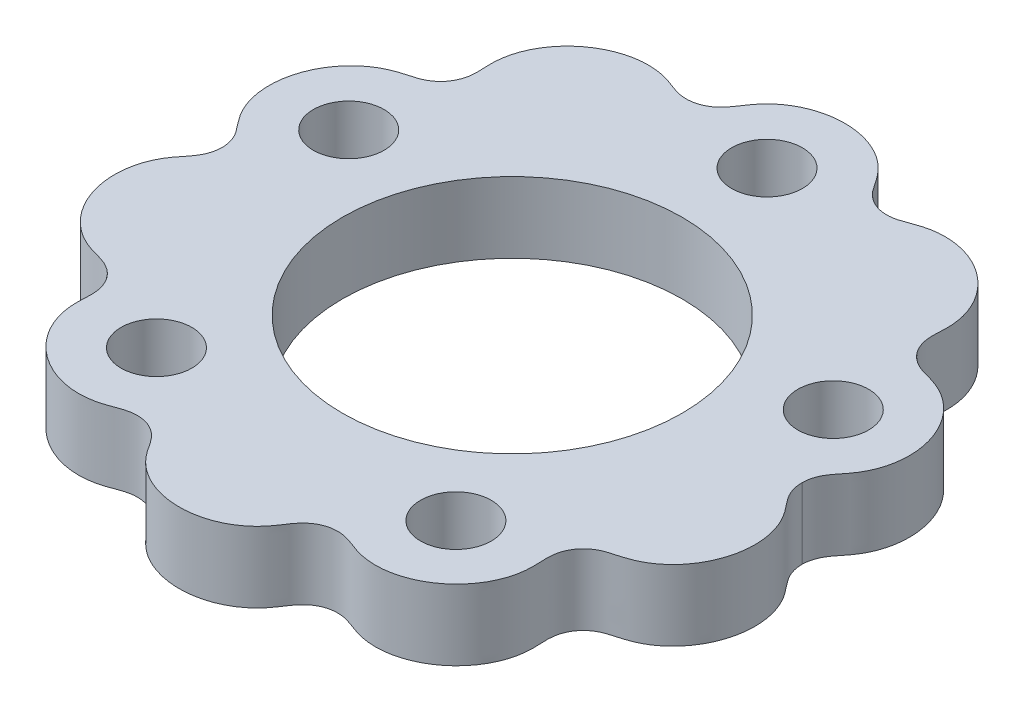
from build123d import *

# Parameters (mm, degrees)
BOSS_EXTRUDE1_OUTLINE_R = 12
BOSS_EXTRUDE1_DEPTH     = 5
SKETCH2_R               = 2.5
CUT_EXTRUDE1_DEPTH      = 34.029669097


# Read off the part's stored shape, not the designer's step: Boss-Extrude1
with BuildPart() as part:
    # Boss-Extrude1 outline → Boss-Extrude1 (new body)
    with BuildSketch(Plane(origin=(0, 0, 0), x_dir=(1, 0, 0), z_dir=(0, 1, 0))):
        with BuildLine():
            ThreePointArc((20.483482608, -0.022701296), (20.482946027, 0.001669628), (20.484024222, 0.026022603))
            add(Edge.make_bspline(
                [(20.484024222, 0.026022603), (20.487498075, 0.188449943), (20.530692051, 0.524452044), (20.676605138, 0.939855681), (20.802634756, 1.18673961), (20.961995807, 1.448332504), (21.103456977, 1.638126813), (21.234268351, 1.805069819), (21.341850472, 1.938204845), (21.465407288, 2.092648377), (21.599078876, 2.266000463), (21.740930616, 2.465610009), (21.913489757, 2.732637863), (22.102223598, 3.075517883), (22.289904472, 3.509157538), (22.437675663, 3.962561926), (22.544640093, 4.431900547), (22.631850119, 5.073155969), (22.635931659, 5.892477364), (22.474096645, 6.86952319), (22.151728017, 7.808025598), (21.679261623, 8.677237815), (21.173033913, 9.319065357), (20.710752428, 9.768857794), (20.338353665, 10.071217564), (19.943847721, 10.335367186), (19.598891474, 10.521922061), (19.311964608, 10.651672399), (19.091956238, 10.738997875), (18.861451659, 10.818617448), (18.61317139, 10.893641797), (18.375579531, 10.957979655), (18.124796572, 11.027363516), (17.87665533, 11.103974461), (17.555751292, 11.224627206), (17.173288609, 11.441745247), (16.81334335, 11.727777943), (16.474600981, 12.147137503), (16.187739874, 12.75401822), (16.110035958, 13.286707461), (16.101145961, 13.633535427), (16.108138063, 13.871526014), (16.117051473, 14.056213577), (16.127246931, 14.261703011), (16.135044654, 14.487223072), (16.134629824, 14.733331839), (16.12371617, 14.972608497), (16.094845812, 15.286098127), (16.031278198, 15.672776569), (15.910561477, 16.131316665), (15.691813887, 16.731029916), (15.314101069, 17.448746146), (14.712156044, 18.228522502), (13.983552915, 18.900490371), (13.152833257, 19.442864111), (12.247010156, 19.837678366), (11.454948784, 20.031636277), (10.815848468, 20.100832305), (10.337906347, 20.10906687), (9.866841828, 20.073375872), (9.479788087, 20.006734617), (9.173543214, 19.93146259), (8.941882382, 19.863101119), (8.699884696, 19.780888465), (8.478681878, 19.697619173), (8.25439962, 19.612950764), (8.039096318, 19.535005666), (7.722900473, 19.439995413), (7.246293364, 19.345266512), (6.602500608, 19.395481633), (6.089120799, 19.560365293), (5.672117431, 19.808452615), (5.305999577, 20.124285394), (5.078921017, 20.40391826), (4.920311032, 20.626432722), (4.809222169, 20.794669312), (4.689166945, 20.978745579), (4.562040932, 21.169532321), (4.416151439, 21.37314115), (4.268176964, 21.561900668), (4.113737202, 21.741360439), (3.898082894, 21.969212564), (3.608438394, 22.23456811), (3.228852964, 22.521898573), (2.684883678, 22.86029441), (1.943119792, 23.194262658), (0.987404123, 23.439533786), (-0.000909374, 23.522141981), (-0.989212315, 23.439776155), (-1.94492202, 23.194742468), (-2.686678182, 22.860918693), (-3.230573149, 22.522671486), (-3.610133163, 22.235409047), (-3.899718695, 21.970126207), (-4.115528168, 21.742131822), (-4.269891912, 21.562834171), (-4.417749348, 21.374133513), (-4.564935932, 21.169064813), (-4.691828328, 20.978831656), (-4.813775805, 20.79231291), (-4.9285933, 20.620152319), (-5.088480229, 20.396895814), (-5.336126588, 20.100397089), (-5.699324257, 19.799550244), (-5.997626627, 19.62917058), (-6.248701845, 19.523313061), (-6.445301067, 19.459719164), (-6.764166519, 19.390476705), (-7.295847059, 19.36359475), (-7.749251022, 19.460357959), (-8.056533891, 19.554607048), (-8.26732387, 19.631848292), (-8.488541821, 19.71597268), (-8.707472614, 19.798450199), (-8.949916333, 19.881059383), (-9.180488999, 19.949051155), (-9.487273251, 20.024561137), (-9.873745892, 20.091009534), (-10.345284348, 20.126848838), (-10.823029672, 20.118627653), (-11.462410445, 20.049501234), (-12.254502053, 19.855685927), (-13.160508382, 19.461037812), (-13.991355974, 18.918874917), (-14.72010821, 18.247088281), (-15.322164197, 17.467524749), (-15.699958999, 16.749923834), (-15.918725525, 16.150354971), (-16.039433209, 15.691967777), (-16.103025666, 15.305277448), (-16.131967956, 14.991400172), (-16.142813041, 14.753268658), (-16.143356335, 14.504075458), (-16.1357289, 14.280150498), (-16.125631177, 14.072159738), (-16.117023412, 13.883426319), (-16.11083046, 13.641049489), (-16.123194148, 13.281742738), (-16.21061611, 12.731348611), (-16.531307379, 12.106396428), (-16.876461465, 11.710246614), (-17.231913629, 11.441783492), (-17.602663361, 11.240760348), (-17.910777396, 11.127665395), (-18.153454769, 11.054023402), (-18.401200138, 10.98613142), (-18.637103225, 10.922480505), (-18.884171953, 10.848026153), (-19.114338145, 10.768473767), (-19.335001351, 10.680986047), (-19.620928799, 10.551687016), (-19.966514514, 10.364812301), (-20.360963807, 10.10073738), (-20.733455869, 9.798384102), (-21.195859728, 9.348594199), (-21.702289342, 8.706784186), (-22.174963712, 7.837648284), (-22.497573667, 6.899229098), (-22.65962538, 5.922227858), (-22.655723325, 5.103012062), (-22.568623751, 4.461874603), (-22.461695557, 3.992399748), (-22.314078358, 3.539257333), (-22.126420731, 3.105727935), (-21.937559918, 2.76250434), (-21.765038345, 2.49544879), (-21.623590087, 2.296437672), (-21.488037695, 2.120277827), (-21.364983313, 1.966235295), (-21.256446717, 1.830934938), (-21.123255839, 1.662051807), (-20.947084088, 1.414320873), (-20.730052707, 1.057488792), (-20.551889884, 0.508057621), (-20.495642746, -0.006716675), (-20.565308212, -0.539990924), (-20.742785099, -1.047747049), (-20.961660539, -1.410570846), (-21.133990457, -1.645993338), (-21.261320598, -1.808220095), (-21.373112147, -1.947174508), (-21.498886348, -2.103772464), (-21.628834978, -2.272146307), (-21.772382727, -2.474071812), (-21.945383476, -2.741516326), (-22.133866418, -3.083277666), (-22.321964261, -3.517419744), (-22.519348085, -4.1217213), (-22.663804546, -4.917131603), (-22.669181586, -5.90034295), (-22.507818084, -6.87743216), (-22.185890414, -7.816114935), (-21.71387228, -8.685523348), (-21.207879664, -9.327692847), (-20.745842211, -9.777721588), (-20.373678844, -10.080203165), (-19.97909862, -10.344699087), (-19.634142334, -10.531517144), (-19.348092708, -10.661039981), (-19.126596675, -10.74905869), (-18.898245911, -10.828140917), (-18.648093691, -10.90374931), (-18.41313658, -10.967488915), (-18.162538358, -11.036688558), (-17.915753005, -11.11264413), (-17.601165644, -11.230241123), (-17.221381244, -11.442162592), (-16.861455017, -11.724858114), (-16.524117766, -12.131326573), (-16.221829568, -12.753712396), (-16.144685054, -13.285541762), (-16.133835386, -13.637828722), (-16.141060036, -13.877721198), (-16.149787538, -14.062217568), (-16.160194648, -14.270631052), (-16.168002875, -14.493499317), (-16.167666041, -14.742323834), (-16.156987331, -14.980142613), (-16.128200854, -15.294027499), (-16.064814733, -15.681105278), (-15.944456465, -16.139231896), (-15.725947706, -16.739248893), (-15.34867972, -17.457034309), (-14.747080491, -18.237128225), (-14.018859947, -18.909408381), (-13.188331167, -19.452217306), (-12.282783759, -19.847437533), (-11.490660023, -20.041842483), (-10.851631737, -20.111351638), (-10.373888312, -20.119846093), (-9.901992593, -20.084315104), (-9.516253339, -20.018180006), (-9.208698683, -19.942680569), (-8.977914753, -19.874824001), (-8.735513257, -19.792443746), (-8.515356493, -19.709762142), (-8.291751141, -19.625252769), (-8.078229066, -19.547738441), (-7.764013449, -19.453006301), (-7.295517626, -19.357609564), (-6.658994057, -19.402395457), (-6.147955902, -19.558930623), (-5.716767948, -19.810404474), (-5.351972422, -20.121918206), (-5.114694002, -20.410127983), (-4.956528669, -20.632693371), (-4.844910233, -20.801207762), (-4.723525558, -20.987351176), (-4.597256761, -21.177135665), (-4.45052381, -21.381936069), (-4.302940535, -21.570547115), (-4.148824966, -21.749743242), (-3.932831666, -21.978193929), (-3.643599864, -22.243503456), (-3.264206818, -22.530988571), (-2.720315215, -22.869715999), (-1.978877365, -23.204007164), (-1.023205005, -23.449755929), (-0.034998941, -23.532834386), (0.953385275, -23.450944823), (1.9092188, -23.206366652), (2.651157417, -22.87292644), (3.195281183, -22.534921165), (3.575004239, -22.247855512), (3.86478012, -21.982697925), (4.080580066, -21.754961478), (4.23514645, -21.57557454), (4.383364652, -21.386759226), (4.529580941, -21.183026421), (4.65738834, -20.991671661), (4.778477437, -20.80665211), (4.891616963, -20.636296258), (5.053189511, -20.411400462), (5.289502902, -20.124674971), (5.670171567, -19.805588944), (6.102163406, -19.560784911), (6.617418298, -19.409050709), (7.248513587, -19.372393245), (7.707599521, -19.468686701), (8.017819809, -19.563345845), (8.229646926, -19.640814291), (8.452011928, -19.725236474), (8.672111974, -19.808388421), (8.91365451, -19.890667187), (9.145140953, -19.959144942), (9.451218585, -20.034578645), (9.838254154, -20.101448115), (10.309352303, -20.137430175), (10.78734575, -20.129494703), (11.42655748, -20.060710043), (12.218814391, -19.867282115), (13.124946632, -19.473101683), (13.95608096, -18.931324695), (14.685137403, -18.259904072), (15.287627116, -17.480579717), (15.665746418, -16.763241564), (15.884937302, -16.163515868), (16.005770549, -15.705691095), (16.069696006, -15.318160776), (16.098745748, -15.005230283), (16.109726549, -14.7663809), (16.110412096, -14.517999491), (16.102813185, -14.294635255), (16.09279229, -14.085620949), (16.08422334, -13.899743077), (16.077965173, -13.658940866), (16.088772753, -13.30347835), (16.175537788, -12.754686637), (16.481837125, -12.142258297), (16.827426224, -11.734921958), (17.184341376, -11.461968499), (17.557418625, -11.256453014), (17.871786665, -11.140301507), (18.115661283, -11.066065435), (18.364309167, -10.997844334), (18.600714137, -10.934163731), (18.848578678, -10.859498952), (19.078958079, -10.780099092), (19.298947222, -10.692942802), (19.585893836, -10.563387904), (19.931020705, -10.377004645), (20.325714949, -10.113080224), (20.698351126, -9.810923397), (21.160975291, -9.361394641), (21.667681892, -8.719879055), (22.140789664, -7.850974495), (22.463842591, -6.912709512), (22.62637789, -5.935796812), (22.622876122, -5.116546178), (22.536094668, -4.475245619), (22.429472072, -4.00595448), (22.281935534, -3.552373439), (22.094696367, -3.118949141), (21.905755074, -2.775298178), (21.733908872, -2.508982939), (21.591271441, -2.307998221), (21.458412684, -2.135319592), (21.333524865, -1.97889466), (21.2262939, -1.845446198), (21.092974262, -1.675207996), (20.919870429, -1.437566807), (20.722356442, -1.101733578), (20.59487432, -0.757362241), (20.508086726, -0.432992605), (20.483343285, -0.187278455), (20.483482608, -0.022701296)],
                knots=[0.076608735, 0.076608735, 0.076608735, 0.076608735, 0.077022241, 0.077435747, 0.077849252, 0.078262758, 0.079089769, 0.079916781, 0.080743792, 0.081570804, 0.083224826, 0.084878849, 0.086532872, 0.089840917, 0.093148962, 0.096457008, 0.099765053, 0.103073099, 0.10968919, 0.11630528, 0.122921371, 0.129537462, 0.136153553, 0.139461598, 0.142769644, 0.146077689, 0.149385734, 0.151039757, 0.15269378, 0.154347803, 0.156001825, 0.157655848, 0.158482859, 0.159309871, 0.160136882, 0.160550388, 0.160963893, 0.161377399, 0.161790905, 0.162617916, 0.163444927, 0.164271939, 0.16509895, 0.165925961, 0.167579984, 0.169234007, 0.17088803, 0.172542052, 0.175850098, 0.179158143, 0.182466189, 0.189082279, 0.19569837, 0.202314461, 0.208930552, 0.215546643, 0.222162733, 0.225470779, 0.228778824, 0.23208687, 0.235394915, 0.237048938, 0.23870296, 0.240356983, 0.242011006, 0.242838017, 0.243665029, 0.24449204, 0.245319051, 0.245732557, 0.246146063, 0.246559568, 0.246973074, 0.247800085, 0.248627097, 0.249454108, 0.250281119, 0.251935142, 0.253589165, 0.255243188, 0.25689721, 0.258551233, 0.261859278, 0.265167324, 0.268475369, 0.27509146, 0.281707551, 0.288323642, 0.294939732, 0.301555823, 0.308171914, 0.311479959, 0.314788005, 0.31809605, 0.319750073, 0.321404096, 0.323058118, 0.324712141, 0.326366164, 0.327193175, 0.328020187, 0.328847198, 0.329674209, 0.330087715, 0.330429401, 0.330532778, 0.330739531, 0.330914726, 0.331328232, 0.332155243, 0.332982255, 0.333809266, 0.334636277, 0.3362903, 0.337944323, 0.339598345, 0.341252368, 0.344560414, 0.347868459, 0.351176504, 0.35448455, 0.361100641, 0.367716731, 0.374332822, 0.380948913, 0.387565004, 0.394181095, 0.39748914, 0.400797186, 0.404105231, 0.405759254, 0.407413276, 0.409067299, 0.410721322, 0.411548333, 0.412375344, 0.413202356, 0.414029367, 0.414856379, 0.415269884, 0.41568339, 0.416096896, 0.416510401, 0.417337413, 0.418164424, 0.418991435, 0.420645458, 0.422299481, 0.423953503, 0.425607526, 0.427261549, 0.430569594, 0.43387764, 0.437185685, 0.44049373, 0.447109821, 0.453725912, 0.460342003, 0.466958094, 0.473574185, 0.47688223, 0.480190275, 0.483498321, 0.486806366, 0.490114412, 0.491768434, 0.493422457, 0.49507648, 0.495903491, 0.496730502, 0.497557514, 0.498384525, 0.499211536, 0.499625042, 0.500038548, 0.500452054, 0.500865559, 0.501692571, 0.502519582, 0.503346593, 0.504173605, 0.505000616, 0.506654639, 0.508308661, 0.509962684, 0.513270729, 0.516578775, 0.51988682, 0.526502911, 0.533119002, 0.539735093, 0.546351184, 0.552967274, 0.559583365, 0.562891411, 0.566199456, 0.569507501, 0.572815547, 0.57446957, 0.576123592, 0.577777615, 0.579431638, 0.58108566, 0.581912672, 0.582739683, 0.583566694, 0.5839802, 0.584393706, 0.584807211, 0.585220717, 0.586047728, 0.58687474, 0.587701751, 0.588528763, 0.589355774, 0.591009797, 0.592663819, 0.594317842, 0.595971865, 0.59927991, 0.602587956, 0.605896001, 0.612512092, 0.619128183, 0.625744273, 0.632360364, 0.638976455, 0.645592546, 0.648900591, 0.652208637, 0.655516682, 0.658824728, 0.66047875, 0.662132773, 0.663786796, 0.665440818, 0.66626783, 0.667094841, 0.667921852, 0.668748864, 0.669162369, 0.669575875, 0.669989381, 0.670402886, 0.671229898, 0.672056909, 0.67288392, 0.673710932, 0.675364955, 0.677018977, 0.678673, 0.680327023, 0.681981045, 0.685289091, 0.688597136, 0.691905182, 0.698521272, 0.705137363, 0.711753454, 0.718369545, 0.724985636, 0.731601727, 0.734909772, 0.738217817, 0.741525863, 0.743179885, 0.744833908, 0.746487931, 0.748141954, 0.749795976, 0.750622988, 0.751449999, 0.75227701, 0.753104022, 0.753517527, 0.753931033, 0.754344539, 0.754758044, 0.755585056, 0.756412067, 0.757239078, 0.75806609, 0.759720112, 0.761374135, 0.763028158, 0.764682181, 0.767990226, 0.771298271, 0.774606317, 0.777914362, 0.784530453, 0.791146544, 0.797762635, 0.804378726, 0.810994816, 0.817610907, 0.820918953, 0.824226998, 0.827535043, 0.829189066, 0.830843089, 0.832497112, 0.834151134, 0.834978146, 0.835805157, 0.836632168, 0.83745918, 0.838286191, 0.838699697, 0.839113202, 0.839526708, 0.839940214, 0.840767225, 0.841594236, 0.842421248, 0.84407527, 0.845729293, 0.847383316, 0.849037339, 0.850691361, 0.853999407, 0.857307452, 0.860615497, 0.863923543, 0.870539634, 0.877155725, 0.883771815, 0.890387906, 0.897003997, 0.900312042, 0.903620088, 0.906928133, 0.910236179, 0.913544224, 0.915198247, 0.916852269, 0.918506292, 0.919333304, 0.920160315, 0.920987326, 0.921814338, 0.922641349, 0.922848102, 0.923054855, 0.92346836, 0.92346836, 0.92346836, 0.92346836], degree=3))
        make_face()
        Circle(BOSS_EXTRUDE1_OUTLINE_R, mode=Mode.SUBTRACT)
    extrude(amount=BOSS_EXTRUDE1_DEPTH)

    # Sketch2 → Cut-Extrude1 (cut, through all)
    with BuildSketch(Plane(origin=(0, 5, 0), x_dir=(1, 0, 0), z_dir=(0, 1, 0))):
        with Locations(Location((0, 18, 0), (0, 0, 270))):
            Circle(SKETCH2_R)
        with Locations(Location((17.119017293, 5.562305899, 0), (0, 0, 270))):
            Circle(SKETCH2_R)
        with Locations(Location((10.580134541, -14.562305899, 0), (0, 0, 270))):
            Circle(SKETCH2_R)
        with Locations(Location((-10.580134541, -14.562305899, 0), (0, 0, 270))):
            Circle(SKETCH2_R)
        with Locations(Location((-17.119017293, 5.562305899, 0), (0, 0, 270))):
            Circle(SKETCH2_R)
    extrude(amount=-CUT_EXTRUDE1_DEPTH, mode=Mode.SUBTRACT)


solid = part.part
